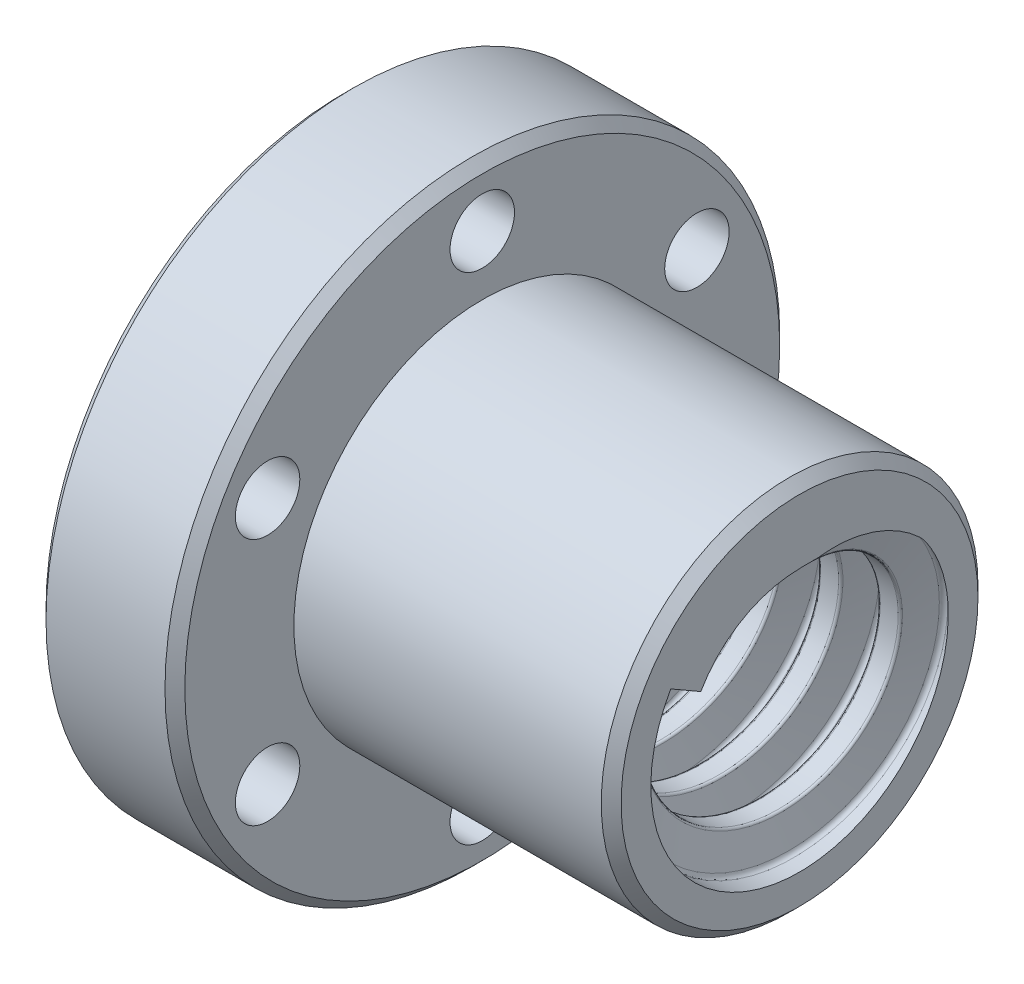
from build123d import *

# Parameters (mm, degrees)
CHAMFER_1_SIZE           = 1
HOLE_WIZARD_M61_D        = 6.5
SKETCH_6_R               = 15
CUT_EXTRUDE_1_DEPTH      = 64.545259461
SWEEP_1_PITCH            = 6
CUT_EXTRUDE_2_DEPTH      = 66.318098428
CUT_EXTRUDE_2_DEPTH_BACK = 66.318098428
SKETCH_7_OUTSIDE_W       = 73.11
SKETCH_7_OUTSIDE_H       = 84.27
SKETCH_7_OUTSIDE_W_2     = 46
SKETCH_7_OUTSIDE_H_2     = 62


with BuildPart() as part:
    # Эскиз1 → Повернуть1 (revolve)
    with BuildSketch(Plane.XY, mode=Mode.PRIVATE) as revolve_1_sk:
        Polygon((0, 0), (0, 31), (14, 31), (14, 19), (46, 19), (46, 0), align=None)
    revolve(revolve_1_sk.sketch.rotate(Axis((0, 0, 0), (-1, 0, 0)), 90), axis=Axis((0, 0, 0), (-1, 0, 0)))

    # Фаска1
    chamfer_1_edges = [part.edges().sort_by_distance(p)[0] for p in [
        (46, 0, 19),
        (14, 0, 31),
        (0, 0, 31),
    ]]
    chamfer(chamfer_1_edges, length=CHAMFER_1_SIZE)

    # Отверстие с зазором M61 (through all)
    with Locations(Plane.ZY):
        with Locations((21.650635095, -12.5), (0, 25), (21.650635095, 12.5), (0, -25), (-21.650635095, -12.5), (-21.650635095, 12.5)):
            Hole(HOLE_WIZARD_M61_D / 2)

    # Эскиз6 → Вытянуть1 (cut, through all)
    with BuildSketch(Plane.ZY):
        Circle(SKETCH_6_R)
    extrude(amount=-CUT_EXTRUDE_1_DEPTH, mode=Mode.SUBTRACT)

    # По траектории1: the profile of Эскиз4 profile screwed along a right-hand helix of 7.666667 turns, 6 arcs to a turn; built about Z, then put on its axis
    sweep_1_z = Axis((0, 0, 0), (0, 0, 1))
    sweep_1_corners = [(11.5, 0, -0.906244464), (11.5, 0, 0.906244464), (11.685295239, 0, 1.147725921), (14.629409523, 0, 1.936598966), (15, 0, 2.419561879), (15.0003, 0, 2.419561879), (15.0003, 0, -2.419561879), (15, 0, -2.419561879), (14.629409523, 0, -1.936598966), (11.685295239, 0, -1.147725921)]
    with BuildLine(mode=Mode.PRIVATE) as sweep_1_profile:
        Line(sweep_1_corners[0], sweep_1_corners[1])
        Line(sweep_1_corners[2], sweep_1_corners[3])
        Line(sweep_1_corners[5], sweep_1_corners[6])
        Line(sweep_1_corners[8], sweep_1_corners[9])
        Line(sweep_1_corners[4], sweep_1_corners[5])
        Line(sweep_1_corners[7], sweep_1_corners[6])
        ThreePointArc((11.5, 0, 0.906244464), (11.551661665, 0, 1.058434822), (11.685295239, 0, 1.147725921))
        ThreePointArc((14.629409523, 0, 1.936598966), (14.89667667, 0, 2.115181164), (15, 0, 2.419561879))
        ThreePointArc((15, 0, -2.419561879), (14.89667667, 0, -2.115181164), (14.629409523, 0, -1.936598966))
        ThreePointArc((11.685295239, 0, -1.147725921), (11.551661665, 0, -1.058434822), (11.5, 0, -0.906244464))
    sweep_1_cap = Face(sweep_1_profile.wire())
    sweep_1_arcs = [((11.5, 0, 0.906244464), (11.5, 0, 1.098076211), (11.685295239, 0, 1.147725921), (1, 0.7933533402912473, 1)), ((14.629409523, 0, 1.936598966), (15, 0, 2.035898385), (15, 0, 2.419561879), (1, 0.7933533402912413, 1)), ((15, 0, -2.419561879), (15, 0, -2.035898385), (14.629409523, 0, -1.936598966), (1, 0.7933533402912413, 1)), ((11.685295239, 0, -1.147725921), (11.5, 0, -1.098076211), (11.5, 0, -0.906244464), (1, 0.7933533402912453, 1))]  # start, shoulder, end, weights
    sweep_1_turn_angles = [0, 30, 60, 90, 120, 150, 180, 210, 240, 270, 300, 330, 360]
    sweep_1_turn_weights = [1, 0.8660254037844387, 1, 0.8660254037844387, 1, 0.8660254037844387, 1, 0.8660254037844387, 1, 0.8660254037844387, 1, 0.8660254037844387, 1]
    sweep_1_turn_rails = [Edge.make_bspline([Vector(p[0], p[1], 0).rotate(sweep_1_z, sweep_1_turn_angles[k]) / sweep_1_turn_weights[k] + Vector(0, 0, p[2] + SWEEP_1_PITCH * sweep_1_turn_angles[k] / 360) for k in range(13)], [0, 0, 0, 1, 1, 2, 2, 3, 3, 4, 4, 5, 5, 6, 6, 6], 2, sweep_1_turn_weights) for p in sweep_1_corners]
    sweep_1_turn_sides = [*[Face.make_surface_from_curves(sweep_1_turn_rails[p[0]], sweep_1_turn_rails[p[1]]) for p in [(0, 1), (2, 3), (5, 6), (8, 9), (4, 5), (7, 6)]], *[Face.make_bezier_surface([[Vector(p[j][0], p[j][1], 0).rotate(sweep_1_z, sweep_1_turn_angles[2 * i + k]) / sweep_1_turn_weights[2 * i + k] + Vector(0, 0, p[j][2] + SWEEP_1_PITCH * sweep_1_turn_angles[2 * i + k] / 360) for k in range(3)] for j in range(3)], [[p[3][j] * sweep_1_turn_weights[2 * i + k] for k in range(3)] for j in range(3)]) for p in sweep_1_arcs for i in range(6)]]
    sweep_1_last_angles = [2520, 2550, 2580, 2610, 2640, 2670, 2700, 2730, 2760]
    sweep_1_last_weights = [1, 0.8660254037844387, 1, 0.8660254037844387, 1, 0.8660254037844387, 1, 0.866025403784401, 1]
    sweep_1_last_rails = [Edge.make_bspline([Vector(p[0], p[1], 0).rotate(sweep_1_z, sweep_1_last_angles[k]) / sweep_1_last_weights[k] + Vector(0, 0, p[2] + SWEEP_1_PITCH * sweep_1_last_angles[k] / 360) for k in range(9)], [0, 0, 0, 1, 1, 2, 2, 3, 3, 4, 4, 4], 2, sweep_1_last_weights) for p in sweep_1_corners]
    sweep_1_last_sides = [*[Face.make_surface_from_curves(sweep_1_last_rails[p[0]], sweep_1_last_rails[p[1]]) for p in [(0, 1), (2, 3), (5, 6), (8, 9), (4, 5), (7, 6)]], *[Face.make_bezier_surface([[Vector(p[j][0], p[j][1], 0).rotate(sweep_1_z, sweep_1_last_angles[2 * i + k]) / sweep_1_last_weights[2 * i + k] + Vector(0, 0, p[j][2] + SWEEP_1_PITCH * sweep_1_last_angles[2 * i + k] / 360) for k in range(3)] for j in range(3)], [[p[3][j] * sweep_1_last_weights[2 * i + k] for k in range(3)] for j in range(3)]) for p in sweep_1_arcs for i in range(4)]]
    sweep_1 = Plane(origin=(0, 0, 0), x_dir=(0, -1, 0), z_dir=(1, 0, 0)) * Solid(Shell([*[p.moved(Location((0, 0, SWEEP_1_PITCH * i))) for i in range(7) for p in sweep_1_turn_sides], *sweep_1_last_sides, sweep_1_cap, sweep_1_cap.rotate(sweep_1_z, 2760).moved(Location((0, 0, SWEEP_1_PITCH * 2760 / 360)))]))
    add(sweep_1)

    # Эскиз7 outside → Вытянуть2 (cut, two sides: drawn at the far end of the back side and taken through both)
    with BuildSketch(Plane.XY.offset(-CUT_EXTRUDE_2_DEPTH_BACK)):
        with Locations((23, 0)):
            Rectangle(SKETCH_7_OUTSIDE_W, SKETCH_7_OUTSIDE_H)
        with Locations((23, 0)):
            Rectangle(SKETCH_7_OUTSIDE_W_2, SKETCH_7_OUTSIDE_H_2, mode=Mode.SUBTRACT)
    extrude(amount=CUT_EXTRUDE_2_DEPTH + CUT_EXTRUDE_2_DEPTH_BACK, mode=Mode.SUBTRACT)


solid = part.part
